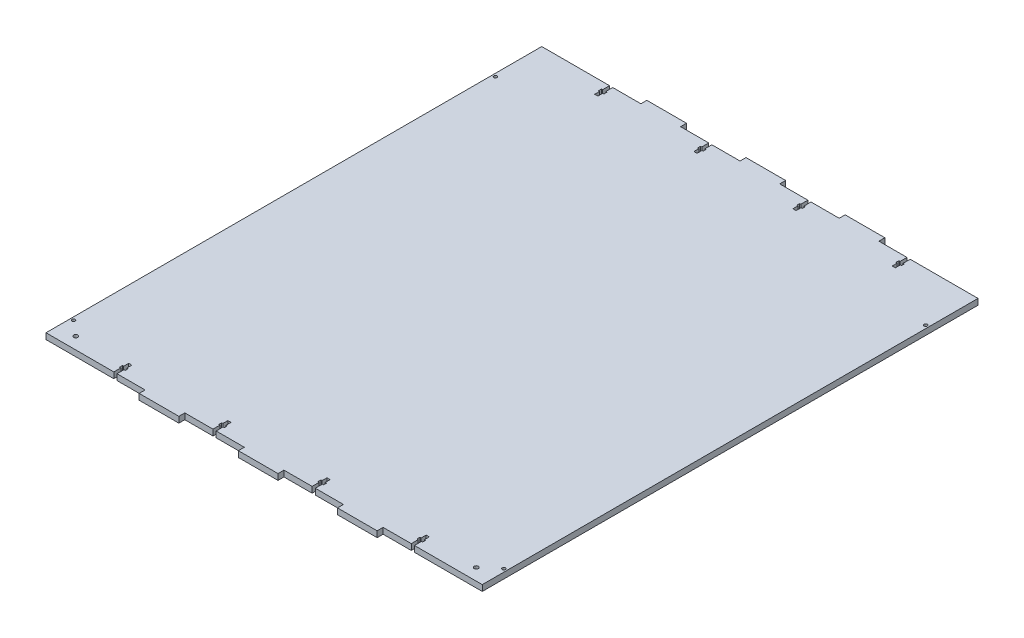
from build123d import *

# Parameters (mm, degrees)
SKETCH1_W           = 440
SKETCH1_H           = 500
BOSS_EXTRUDE1_DEPTH = 6
SKETCH2_W           = 40
SKETCH2_H           = 6
BOSS_EXTRUDE2_DEPTH = 6
SKETCH3_R           = 1.6
SKETCH3_R_2         = 2.1
CUT_EXTRUDE1_DEPTH  = 338.597393355


with BuildPart() as part:
    # Sketch1 → Boss-Extrude1 (new body)
    with BuildSketch(Plane(origin=(0, 0, 0), x_dir=(1, 0, 0), z_dir=(0, 1, 0))):
        Rectangle(SKETCH1_W, SKETCH1_H)
    extrude(amount=BOSS_EXTRUDE1_DEPTH)

    # Sketch2 → Boss-Extrude2 (add)
    with BuildSketch(Plane.XZ):
        with Locations((-100, 253)):
            Rectangle(SKETCH2_W, SKETCH2_H)
        with Locations((0, 253)):
            Rectangle(SKETCH2_W, SKETCH2_H)
        with Locations((100, 253)):
            Rectangle(SKETCH2_W, SKETCH2_H)
        with Locations((100, -253)):
            Rectangle(SKETCH2_W, SKETCH2_H)
        with Locations((0, -253)):
            Rectangle(SKETCH2_W, SKETCH2_H)
        with Locations((-100, -253)):
            Rectangle(SKETCH2_W, SKETCH2_H)
    extrude(amount=-BOSS_EXTRUDE2_DEPTH)

    # Sketch3 → Cut-Extrude1 (cut, through all)
    with BuildSketch(Plane.XZ):
        Polygon((-148.4, -235), (-151.6, -235), (-151.6, -240), (-152.8, -240), (-152.8, -243), (-151.6, -243), (-151.6, -250), (-148.4, -250), (-148.4, -243), (-147.2, -243), (-147.2, -240), (-148.4, -240), align=None)
        Polygon((-48.4, -235), (-51.6, -235), (-51.6, -240), (-52.8, -240), (-52.8, -243), (-51.6, -243), (-51.6, -250), (-48.4, -250), (-48.4, -243), (-47.2, -243), (-47.2, -240), (-48.4, -240), align=None)
        Polygon((51.6, -235), (48.4, -235), (48.4, -240), (47.2, -240), (47.2, -243), (48.4, -243), (48.4, -250), (51.6, -250), (51.6, -243), (52.8, -243), (52.8, -240), (51.6, -240), align=None)
        Polygon((151.6, -235), (148.4, -235), (148.4, -240), (147.2, -240), (147.2, -243), (148.4, -243), (148.4, -250), (151.6, -250), (151.6, -243), (152.8, -243), (152.8, -240), (151.6, -240), align=None)
        Polygon((-148.4, 235), (-148.4, 240), (-147.2, 240), (-147.2, 243), (-148.4, 243), (-148.4, 250), (-151.6, 250), (-151.6, 243), (-152.8, 243), (-152.8, 240), (-151.6, 240), (-151.6, 235), align=None)
        Polygon((-48.4, 235), (-48.4, 240), (-47.2, 240), (-47.2, 243), (-48.4, 243), (-48.4, 250), (-51.6, 250), (-51.6, 243), (-52.8, 243), (-52.8, 240), (-51.6, 240), (-51.6, 235), align=None)
        Polygon((51.6, 235), (51.6, 240), (52.8, 240), (52.8, 243), (51.6, 243), (51.6, 250), (48.4, 250), (48.4, 243), (47.2, 243), (47.2, 240), (48.4, 240), (48.4, 235), align=None)
        Polygon((151.6, 235), (151.6, 240), (152.8, 240), (152.8, 243), (151.6, 243), (151.6, 250), (148.4, 250), (148.4, 243), (147.2, 243), (147.2, 240), (148.4, 240), (148.4, 235), align=None)
        with Locations((217, -200.25)):
            Circle(SKETCH3_R)
        with Locations((217, 225.25)):
            Circle(SKETCH3_R)
        with Locations((-217, 225.25)):
            Circle(SKETCH3_R)
        with Locations((-217, -200.25)):
            Circle(SKETCH3_R)
        with Locations((-202, 238)):
            Circle(SKETCH3_R_2)
        with Locations((202, 238)):
            Circle(SKETCH3_R_2)
    extrude(amount=-CUT_EXTRUDE1_DEPTH, mode=Mode.SUBTRACT)


solid = part.part
